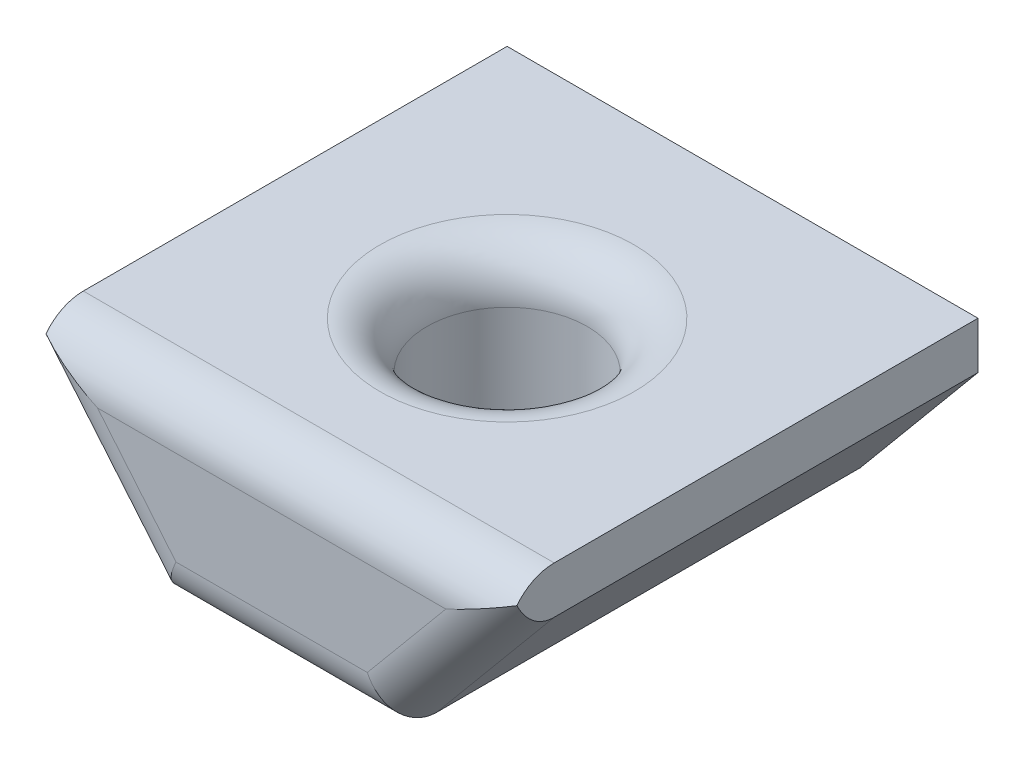
from build123d import *

# Parameters (mm, degrees)
BOSS_EXTRUDE1_DEPTH = 10
SKETCH3_R           = 1.7
CUT_EXTRUDE1_DEPTH  = 12.874342087
FILLET2_R           = 1


with BuildPart() as part:
    # Sketch1 → Boss-Extrude1 (new body)
    with BuildSketch(Plane.XY):
        Polygon((-2.5, 0), (2.5, 0), (5, 3), (5, 4), (-5, 4), (-5, 3), align=None)
    extrude(amount=BOSS_EXTRUDE1_DEPTH)

    # Sketch3 → Cut-Extrude1 (cut, through all)
    with BuildSketch(Plane(origin=(0, 4, 0), x_dir=(1, 0, 0), z_dir=(0, 1, 0))):
        with Locations(Location((0, -5, 0), (0, 0, 270))):
            Circle(SKETCH3_R)
    extrude(amount=-CUT_EXTRUDE1_DEPTH, mode=Mode.SUBTRACT)

    # Fillet2
    # the kernel refuses this fillet: 1 mm, written as the material it takes off along each edge
    with BuildSketch(Plane(origin=(-5, 0, 10), x_dir=(0, 0, -1), z_dir=(1, 0, 0))) as fillet2_piece_1:
        with BuildLine():
            CenterArc((FILLET2_R, FILLET2_R), FILLET2_R, 180, 90)
            Line((0, FILLET2_R), (0, 0))
            Line((0, 0), (FILLET2_R, 0))
        make_face()
    extrude(amount=10, mode=Mode.SUBTRACT)
    with BuildSketch(Plane(origin=(0.899539001, -1.920553199, 10), x_dir=(-0.768221279597376, 0.6401843996644797, 0), z_dir=(0.6401843996644797, 0.768221279597376, 0))) as fillet2_piece_2:
        with BuildLine():
            CenterArc((FILLET2_R, -FILLET2_R), FILLET2_R, 90, 90)
            Line((0, -FILLET2_R), (0, 0))
            Line((0, 0), (FILLET2_R, 0))
        make_face()
    extrude(amount=8.905124838, mode=Mode.SUBTRACT)
    with BuildSketch(Plane(origin=(-6.600460999, 4.920553199, 10), x_dir=(0, 0, -1), z_dir=(0.6401843996644797, -0.768221279597376, 0))) as fillet2_piece_3:
        with BuildLine():
            CenterArc((FILLET2_R, FILLET2_R), FILLET2_R, 180, 90)
            Line((0, FILLET2_R), (0, 0))
            Line((0, 0), (FILLET2_R, 0))
        make_face()
    extrude(amount=8.905124838, mode=Mode.SUBTRACT)
    with BuildSketch(Plane(origin=(7.5, 4, 10), x_dir=(0, -1, 0), z_dir=(-1, 0, 0))) as fillet2_piece_4:
        with BuildLine():
            CenterArc((FILLET2_R, -FILLET2_R), FILLET2_R, 90, 90)
            Line((0, -FILLET2_R), (0, 0))
            Line((0, 0), (FILLET2_R, 0))
        make_face()
    extrude(amount=15, mode=Mode.SUBTRACT)
    with BuildSketch(Plane(origin=(0, 4, 5), x_dir=(0, 0, 1), z_dir=(-1, 0, 0))) as fillet2_piece_5:
        with BuildLine():
            CenterArc((1.7 + FILLET2_R, -FILLET2_R), FILLET2_R, 90, 90)
            Line((1.7 + FILLET2_R, 0), (1.7, 0))
            Line((1.7, 0), (1.7, -FILLET2_R))
        make_face()
    revolve(axis=Axis((0, 4, 5), (0, 1, 0)), mode=Mode.SUBTRACT)


solid = part.part
